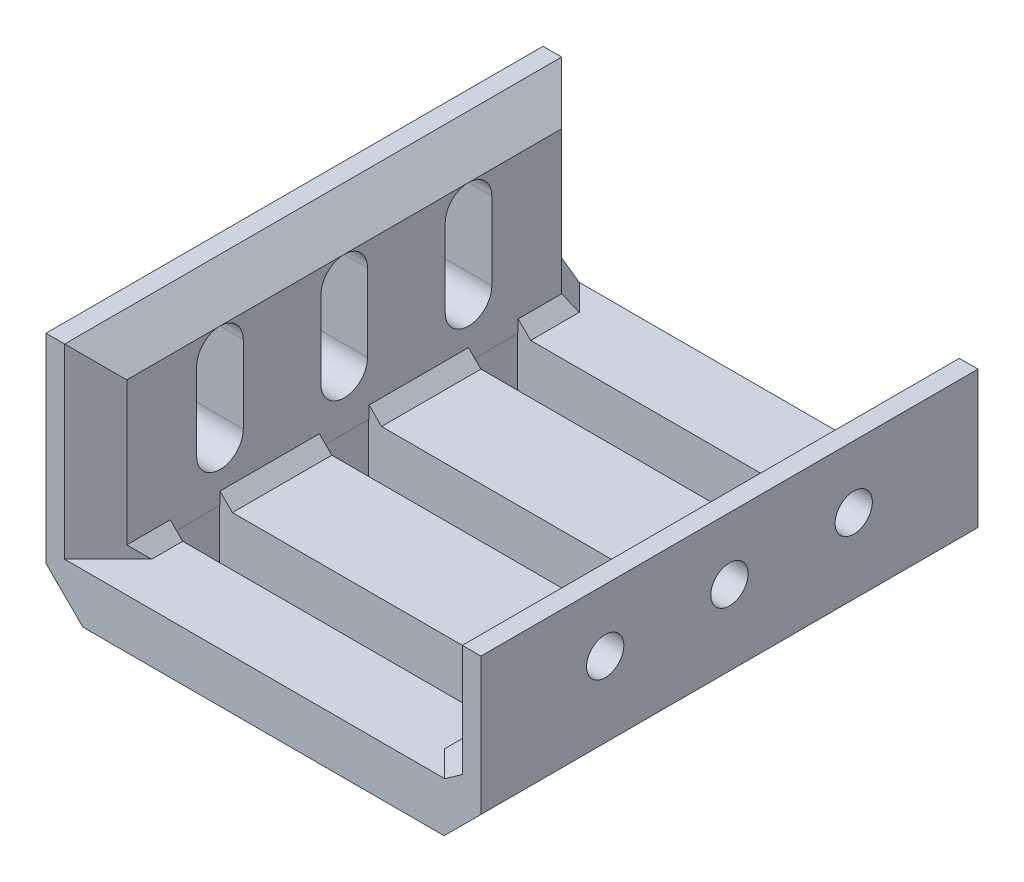
from build123d import *

# Parameters (mm, degrees)
SKETCH1_W           = 44.45
SKETCH1_H           = 50.8
BOSS_EXTRUDE1_DEPTH = 6.35
SKETCH2_W           = 5.08
SKETCH2_H           = 50.8
BOSS_EXTRUDE2_DEPTH = 25.4
SKETCH3_W           = 5.08
SKETCH3_H           = 50.8
BOSS_EXTRUDE3_DEPTH = 19.05
CUT_EXTRUDE1_REACH  = 55.295
CUT_EXTRUDE2_REACH  = 55.295
SKETCH5_R           = 1.905
LPATTERN1_COUNT     = 2
LPATTERN1_PITCH     = 12.7
LPATTERN1_COL_COUNT = 2
LPATTERN1_COL_PITCH = 12.7
CHAMFER3_SIZE       = 5.028946
CHAMFER1_SIZE       = 3.175
CUT_EXTRUDE3_REACH  = 40.756
SKETCH6_W           = 34.392108
SKETCH6_H           = 5.08
LPATTERN2_COUNT     = 2
LPATTERN2_PITCH     = 15.24
LPATTERN2_COL_COUNT = 2
LPATTERN2_COL_PITCH = 15.24
CHAMFER4_SIZE       = 1.27


with BuildPart() as part:
    # Sketch1 → Boss-Extrude1 (new body)
    with BuildSketch(Plane(origin=(0, 0, 0), x_dir=(1, 0, 0), z_dir=(0, 1, 0))):
        Rectangle(SKETCH1_W, SKETCH1_H)
    extrude(amount=BOSS_EXTRUDE1_DEPTH)

    # Sketch2 → Boss-Extrude2 (add)
    with BuildSketch(Plane(origin=(0, 0, 0), x_dir=(1, 0, 0), z_dir=(0, 1, 0))):
        with Locations((-19.685, 0)):
            Rectangle(SKETCH2_W, SKETCH2_H)
    extrude(amount=BOSS_EXTRUDE2_DEPTH)

    # Sketch3 → Boss-Extrude3 (add)
    with BuildSketch(Plane(origin=(0, 0, 0), x_dir=(1, 0, 0), z_dir=(0, 1, 0))):
        with Locations((19.685, 0)):
            Rectangle(SKETCH3_W, SKETCH3_H)
    extrude(amount=BOSS_EXTRUDE3_DEPTH)

    # Sketch4 → Cut-Extrude1 (cut, up to next)
    with BuildSketch(Plane(origin=(-17.145, 0, 0), x_dir=(0, 0, -1), z_dir=(1, 0, 0)), mode=Mode.PRIVATE) as cut_extrude1_sk1:
        with BuildLine():
            Line((-2.38125, 11.90625), (-2.38125, 19.84375))
            ThreePointArc((-2.38125, 19.84375), (0, 22.225), (2.38125, 19.84375))
            Line((2.38125, 19.84375), (2.38125, 11.90625))
            ThreePointArc((2.38125, 11.90625), (0, 9.525), (-2.38125, 11.90625))
        make_face()
    cut_extrude1_tool1 = extrude(cut_extrude1_sk1.sketch, amount=-CUT_EXTRUDE1_REACH, mode=Mode.PRIVATE) & part.part
    cut_extrude1 = cut_extrude1_tool1.solids().sort_by_distance((-17.145, 15.875, 0))[0]
    add(cut_extrude1, mode=Mode.SUBTRACT)

    # Sketch5 → Cut-Extrude2 (cut, up to next)
    with BuildSketch(Plane.ZY.offset(-17.145), mode=Mode.PRIVATE) as cut_extrude2_sk1:
        with Locations((0, 12.7)):
            Circle(SKETCH5_R)
    cut_extrude2_tool1 = extrude(cut_extrude2_sk1.sketch, amount=-CUT_EXTRUDE2_REACH, mode=Mode.PRIVATE) & part.part
    cut_extrude2 = cut_extrude2_tool1.solids().sort_by_distance((17.145, 12.7, 0))[0]
    add(cut_extrude2, mode=Mode.SUBTRACT)

    # LPattern1: Cut-Extrude1, Cut-Extrude2 ×2
    with Locations(*[(0, 0, i * LPATTERN1_PITCH) for i in range(1, LPATTERN1_COUNT)]):
        add(cut_extrude1, mode=Mode.SUBTRACT)
        add(cut_extrude2, mode=Mode.SUBTRACT)

    # LPattern1 col: Cut-Extrude1, Cut-Extrude2 ×2
    with Locations(*[(0, 0, -i * LPATTERN1_COL_PITCH) for i in range(1, LPATTERN1_COL_COUNT)]):
        add(cut_extrude1, mode=Mode.SUBTRACT)
        add(cut_extrude2, mode=Mode.SUBTRACT)

    # Chamfer3
    chamfer3_edges = [part.edges().sort_by_distance(p)[0] for p in [
        (22.225, 0, 0),
        (-22.225, 0, 0),
    ]]
    chamfer(chamfer3_edges, length=CHAMFER3_SIZE)

    # Chamfer1
    chamfer1_edges = [part.edges().sort_by_distance(p)[0] for p in [
        (-17.145, 15.875, 25.4),
        (-17.145, 15.875, -25.4),
        (-17.145, 25.4, 0),
        (17.145, 12.7, -25.4),
        (17.145, 12.7, 25.4),
        (17.145, 19.05, 0),
    ]]
    chamfer(chamfer1_edges, length=CHAMFER1_SIZE - 0.0001)  # a hair under: the kernel refuses the full size

    # Sketch6 → Cut-Extrude3 (cut, up to next)
    with BuildSketch(Plane(origin=(0, 6.35, 0), x_dir=(1, 0, 0), z_dir=(0, 1, 0)), mode=Mode.PRIVATE) as cut_extrude3_sk1:
        Rectangle(SKETCH6_W, SKETCH6_H)
    cut_extrude3_tool1 = extrude(cut_extrude3_sk1.sketch, amount=-CUT_EXTRUDE3_REACH, mode=Mode.PRIVATE) & part.part
    cut_extrude3 = cut_extrude3_tool1.solids().sort_by_distance((0, 6.35, 0))[0]
    add(cut_extrude3, mode=Mode.SUBTRACT)

    # LPattern2: Cut-Extrude3 ×2
    with Locations(*[(0, 0, i * LPATTERN2_PITCH) for i in range(1, LPATTERN2_COUNT)]):
        add(cut_extrude3, mode=Mode.SUBTRACT)

    # LPattern2 col: Cut-Extrude3 ×2
    with Locations(*[(0, 0, -i * LPATTERN2_COL_PITCH) for i in range(1, LPATTERN2_COL_COUNT)]):
        add(cut_extrude3, mode=Mode.SUBTRACT)

    # Chamfer4
    chamfer4_edges = [part.edges().sort_by_distance(p)[0] for p in [
        (0, 0, 25.4),
        (0, 0, -25.4),
        (17.145, 6.35, -20.00255),
        (-17.145, 6.35, 20.00255),
        (18.73245, 6.35, 23.81255),
        (-18.73245, 6.35, -23.81255),
        (17.145, 6.35, 7.62),
        (-17.145, 6.35, -7.62),
        (0, 0, 2.54),
        (0, 0, -2.54),
        (17.145, 6.35, -7.62),
        (-17.145, 6.35, -20.00255),
        (0, 0, -12.7),
        (0, 0, -17.78),
        (17.145, 6.35, 20.00255),
        (-17.145, 6.35, 7.62),
        (0, 0, 17.78),
        (0, 0, 12.7),
    ]]
    chamfer(chamfer4_edges, length=CHAMFER4_SIZE)


solid = part.part
